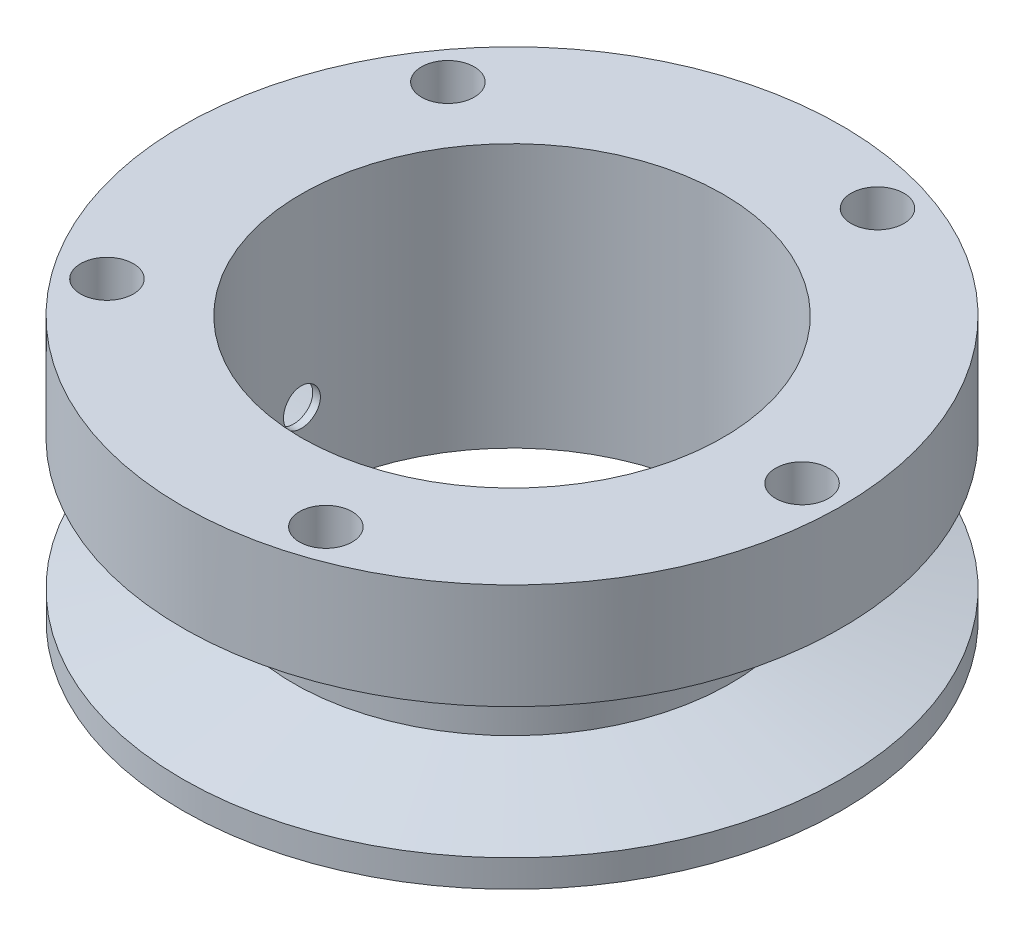
from build123d import *
from build123d.topology import SkipClean

# Parameters (mm, degrees)
SKETCH_1_R          = 12.5
EXTRUDE_1_DEPTH     = 4
SKETCH_2_R          = 1
EXTRUDE_2_DEPTH     = 7.5
SKETCH_5_R          = 6
CUT_EXTRUDE_1_DEPTH = 10
CUT_EXTRUDE_START   = -7.5
SKETCH_7_R          = 1
CUT_EXTRUDE_2_DEPTH = 7.5
SKETCH_8_R          = 12.5
SKETCH_8_R_2        = 6
CUT_EXTRUDE_3_DEPTH = 10
SKETCH_9_R          = 1
EXTRUDE_3_DEPTH     = 10
CUT_EXTRUDE_START_2 = -14
SKETCH_10_R         = 1
CUT_EXTRUDE_4_DEPTH = 14
SKETCH_11_R         = 8
CUT_EXTRUDE_5_DEPTH = 10
EXTRUDE_START       = -10
SKETCH_12_R         = 8
EXTRUDE_4_DEPTH     = 10
SKETCH_14_R         = 8
CUT_EXTRUDE_6_DEPTH = 10
SKETCH_15_W         = 0.086708075
SKETCH_15_H         = 4
SKETCH_16_R         = 0.7
CUT_EXTRUDE_7_DEPTH = 10
SKETCH_18_R         = 12.5
EXTRUDE_5_DEPTH     = 2.07
CUT_EXTRUDE_START_3 = -2.07
SKETCH_20_R         = 8
CUT_EXTRUDE_8_DEPTH = 2.07


with BuildPart() as part:
    # 草图1 → 凸台-拉伸1 (new body)
    with BuildSketch(Plane(origin=(0, 0, 0), x_dir=(1, 0, 0), z_dir=(0, 1, 0))):
        with Locations(Location((0, 0, 0), (0, 0, 270))):
            Circle(SKETCH_1_R)
    extrude(amount=EXTRUDE_1_DEPTH)

    # 草图2 → 凸台-拉伸2 (add)
    with BuildSketch(Plane(origin=(0, 4, 0), x_dir=(1, 0, 0), z_dir=(0, 1, 0))):
        with Locations(Location((10, 0, 0), (0, 0, 270))):
            Circle(SKETCH_2_R)
        with Locations(Location((3.399186938, -10.461621679, 0), (0, 0, 270))):
            Circle(SKETCH_2_R)
        with Locations(Location((-8.590169944, -7.416694292, 0), (0, 0, 270))):
            Circle(SKETCH_2_R)
        with Locations(Location((-9.399186938, 4.926796007, 0), (0, 0, 270))):
            Circle(SKETCH_2_R)
        with Locations(Location((2.090169944, 9.510565163, 0), (0, 0, 270))):
            Circle(SKETCH_2_R)
    extrude(amount=EXTRUDE_2_DEPTH)

    # 草图5 → 切除-拉伸1 (cut)
    with BuildSketch(Plane(origin=(0, 4, 0), x_dir=(1, 0, 0), z_dir=(0, 1, 0))):
        with Locations(Location((0, 0, 0), (0, 0, 270))):
            Circle(SKETCH_5_R)
    extrude(amount=-CUT_EXTRUDE_1_DEPTH, mode=Mode.SUBTRACT)

    # 草图7 → 切除-拉伸2 (cut)
    with BuildSketch(Plane(origin=(0, 11.5, 0), x_dir=(1, 0, 0), z_dir=(0, 1, 0)).offset(CUT_EXTRUDE_START)):
        with Locations((-9.399186938, 4.926796007)):
            Circle(SKETCH_7_R)
    extrude(amount=CUT_EXTRUDE_2_DEPTH, mode=Mode.SUBTRACT)

    # 草图8 → 切除-拉伸3 (cut)
    with BuildSketch(Plane(origin=(0, 4, 0), x_dir=(1, 0, 0), z_dir=(0, 1, 0))):
        with Locations(Location((0, 0, 0), (0, 0, 270))):
            Circle(SKETCH_8_R)
        with Locations(Location((0, 0, 0), (0, 0, 270))):
            Circle(SKETCH_8_R_2, mode=Mode.SUBTRACT)
    extrude(amount=CUT_EXTRUDE_3_DEPTH, mode=Mode.SUBTRACT)

    # 草图9 → 凸台-拉伸3 (add)
    with BuildSketch(Plane(origin=(0, 4, 0), x_dir=(1, 0, 0), z_dir=(0, 1, 0))):
        with Locations(Location((11, 0, 0), (0, 0, 270))):
            Circle(SKETCH_9_R)
        with Locations(Location((3.399186938, -10.461621679, 0), (0, 0, 270))):
            Circle(SKETCH_9_R)
        with Locations(Location((-8.899186938, -6.465637775, 0), (0, 0, 270))):
            Circle(SKETCH_9_R)
        with Locations(Location((-8.899186938, 6.465637775, 0), (0, 0, 270))):
            Circle(SKETCH_9_R)
        with Locations(Location((3.399186938, 10.461621679, 0), (0, 0, 270))):
            Circle(SKETCH_9_R)
    extrude(amount=EXTRUDE_3_DEPTH)

    # 草图10 → 切除-拉伸4 (cut)
    with BuildSketch(Plane(origin=(0, 14, 0), x_dir=(1, 0, 0), z_dir=(0, 1, 0)).offset(CUT_EXTRUDE_START_2)):
        with Locations(Location((-8.899186938, -6.465637775, 0), (0, 0, 270))):
            Circle(SKETCH_10_R)
        with Locations(Location((3.399186938, -10.461621679, 0), (0, 0, 270))):
            Circle(SKETCH_10_R)
        with Locations(Location((11, 0, 0), (0, 0, 270))):
            Circle(SKETCH_10_R)
        with Locations(Location((3.399186938, 10.461621679, 0), (0, 0, 270))):
            Circle(SKETCH_10_R)
        with Locations(Location((-8.899186938, 6.465637775, 0), (0, 0, 270))):
            Circle(SKETCH_10_R)
    extrude(amount=CUT_EXTRUDE_4_DEPTH, mode=Mode.SUBTRACT)

    # 草图11 → 切除-拉伸5 (cut)
    with BuildSketch(Plane(origin=(0, 4, 0), x_dir=(1, 0, 0), z_dir=(0, 1, 0))):
        with Locations(Location((0, 0, 0), (0, 0, 270))):
            Circle(SKETCH_11_R)
    extrude(amount=-CUT_EXTRUDE_5_DEPTH, mode=Mode.SUBTRACT)

    # 草图12 → 凸台-拉伸4 (add)
    # profile 1 of 2: a face of its own
    with BuildSketch(Plane(origin=(0, 4, 0), x_dir=(1, 0, 0), z_dir=(0, 1, 0)).offset(EXTRUDE_START)):
        with BuildLine():
            ThreePointArc((8.48540775, 9.178663046), (2.781152949, 8.559508647), (-1.469756299, 12.413291925))
            ThreePointArc((-1.469756299, 12.413291925), (-3.86271243, 11.888206454), (-6.107292102, 10.906465201))
            ThreePointArc((-6.107292102, 10.906465201), (-7.281152949, 5.290067271), (-12.259921848, 2.438096855))
            ThreePointArc((-12.259921848, 2.438096855), (-12.5, 0), (-12.259921848, -2.438096855))
            ThreePointArc((-12.259921848, -2.438096855), (-7.281152949, -5.290067271), (-6.107292102, -10.906465201))
            ThreePointArc((-6.107292102, -10.906465201), (-3.86271243, -11.888206454), (-1.469756299, -12.413291925))
            ThreePointArc((-1.469756299, -12.413291925), (2.781152949, -8.559508647), (8.48540775, -9.178663046))
            ThreePointArc((8.48540775, -9.178663046), (10.11271243, -7.347315654), (11.3515625, -5.233739467))
            ThreePointArc((11.3515625, -5.233739467), (9, 0), (11.3515625, 5.233739467))
            ThreePointArc((11.3515625, 5.233739467), (10.11271243, 7.347315654), (8.48540775, 9.178663046))
        make_face()
        Circle(SKETCH_12_R, mode=Mode.SUBTRACT)
    # profile 2 of 2: a face of its own
    with BuildSketch(Plane(origin=(0, 4, 0), x_dir=(1, 0, 0), z_dir=(0, 1, 0)).offset(EXTRUDE_START)):
        Circle(SKETCH_12_R)
    extrude(amount=EXTRUDE_4_DEPTH)

    # 草图14 → 切除-拉伸6 (cut)
    with SkipClean():  # the faces are left unmerged after this step: merging them gives an invalid solid
        with BuildSketch(Plane.XZ.offset(6)):
            with Locations(Location((0, 0, 0), (0, 0, 270))):
                Circle(SKETCH_14_R)
        extrude(amount=-CUT_EXTRUDE_6_DEPTH, mode=Mode.SUBTRACT)
    add(part.part.scale(1), mode=Mode.REPLACE)  # the faces are merged on a copy

    # 草图15 → 切除-旋转2 (revolve, cut)
    with BuildSketch(Plane(origin=(0, 0, 0), x_dir=(0, 0, -1), z_dir=(1, 0, 0)), mode=Mode.PRIVATE) as cut_revolve_2_sk:
        with Locations((12.456645963, -3)):
            Rectangle(SKETCH_15_W, SKETCH_15_H)
        Polygon((12.413291925, -1), (12.413291925, -5), (9.178663046, -3.93256933), (9.178663046, -2.06743067), align=None)
    revolve(cut_revolve_2_sk.sketch.rotate(Axis((0, 0, 0), (0, -1, 0)), 353.247512934), axis=Axis((0, 0, 0), (0, -1, 0)), mode=Mode.SUBTRACT)

    # 草图16 → 切除-拉伸7 (cut)
    with BuildSketch(Plane(origin=(0, 0, 0), x_dir=(0, 0, -1), z_dir=(1, 0, 0))):
        with Locations((0, -3)):
            Circle(SKETCH_16_R)
    extrude(amount=-CUT_EXTRUDE_7_DEPTH, mode=Mode.SUBTRACT)

    # 草图17 → 切除-旋转4 (revolve, cut)
    with BuildSketch(Plane(origin=(0, 0, 0), x_dir=(0, 0, -1), z_dir=(1, 0, 0)), mode=Mode.PRIVATE) as cut_revolve_4_sk:
        Polygon((12.5, -1), (9.265914401, -2.06743067), (8.289016568, -2.06743067), (12.5, 0), align=None)
    revolve(cut_revolve_4_sk.sketch.rotate(Axis((0, 0, 0), (0, 1, 0)), 6.752487066), axis=Axis((0, 0, 0), (0, 1, 0)), mode=Mode.SUBTRACT)

    # 草图18 → 凸台-拉伸5 (add)
    with SkipClean():  # the faces are left unmerged after this step: merging them gives an invalid solid
        with BuildSketch(Plane.XZ.offset(6)):
            with Locations(Location((0, 0, 0), (0, 0, 263.247512934))):
                Circle(SKETCH_18_R)
        extrude(amount=-EXTRUDE_5_DEPTH)

    # 草图19 → 切除-旋转5 (revolve, cut)
    with SkipClean():  # the faces are left unmerged after this step: merging them gives an invalid solid
        with BuildSketch(Plane(origin=(0, 0, 0), x_dir=(0, 0, -1), z_dir=(1, 0, 0))):
            Polygon((12.5, -2.06743067), (12.5, -4.965), (8.289016568, -3.93), (8.289016568, -2.06743067), align=None)
        revolve(axis=Axis((0, 0, 0), (0, 1, 0)), mode=Mode.SUBTRACT)

    # 草图20 → 切除-拉伸8 (cut)
    with SkipClean():  # the faces are left unmerged after this step: merging them gives an invalid solid
        with BuildSketch(Plane(origin=(0, -3.93, 0), x_dir=(1, 0, 0), z_dir=(0, 1, 0)).offset(CUT_EXTRUDE_START_3)):
            with Locations(Location((0, 0, 0), (0, 0, 90))):
                Circle(SKETCH_20_R)
        extrude(amount=CUT_EXTRUDE_8_DEPTH, mode=Mode.SUBTRACT)


solid = part.part
